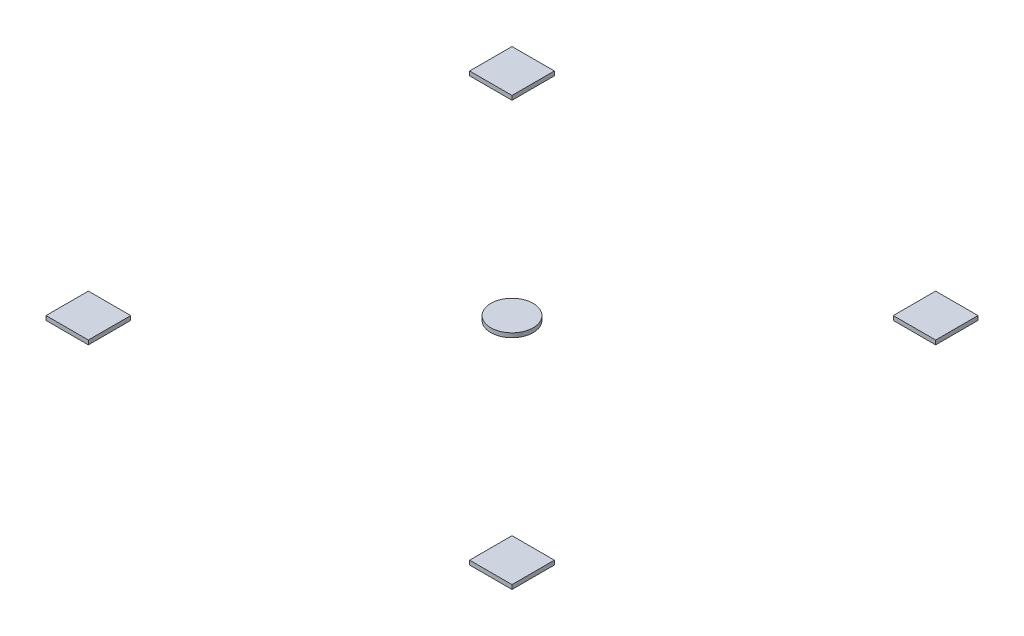
from build123d import *

# Parameters (mm, degrees)
SKIZZE1_R                         = 10
AUFSATZ_LINEAR_AUSTRAGEN1_DEPTH   = 2
SKIZZE1_W                         = 20
SKIZZE1_H                         = 20
AUFSATZ_LINEAR_AUSTRAGEN1_2_DEPTH = 2
AUFSATZ_LINEAR_AUSTRAGEN1_3_DEPTH = 2
AUFSATZ_LINEAR_AUSTRAGEN1_4_DEPTH = 2
AUFSATZ_LINEAR_AUSTRAGEN1_5_DEPTH = 2


with BuildPart() as part:
    # Skizze1 → Aufsatz-Linear austragen1 (new body)
    with BuildSketch(Plane(origin=(0, 0, 0), x_dir=(1, 0, 0), z_dir=(0, 1, 0))):
        Circle(SKIZZE1_R)
    extrude(amount=AUFSATZ_LINEAR_AUSTRAGEN1_DEPTH)


with BuildPart() as body_2:
    # Skizze1 → Aufsatz-Linear austragen1 2 (new body)
    with BuildSketch(Plane(origin=(0, 0, 0), x_dir=(1, 0, 0), z_dir=(0, 1, 0))):
        with Locations((100, 100)):
            Rectangle(SKIZZE1_W, SKIZZE1_H)
    extrude(amount=AUFSATZ_LINEAR_AUSTRAGEN1_2_DEPTH)


with BuildPart() as body_3:
    # Skizze1 → Aufsatz-Linear austragen1 3 (new body)
    with BuildSketch(Plane(origin=(0, 0, 0), x_dir=(1, 0, 0), z_dir=(0, 1, 0))):
        with Locations((-100, 100)):
            Rectangle(SKIZZE1_W, SKIZZE1_H)
    extrude(amount=AUFSATZ_LINEAR_AUSTRAGEN1_3_DEPTH)


with BuildPart() as body_4:
    # Skizze1 → Aufsatz-Linear austragen1 4 (new body)
    with BuildSketch(Plane(origin=(0, 0, 0), x_dir=(1, 0, 0), z_dir=(0, 1, 0))):
        with Locations((100, -100)):
            Rectangle(SKIZZE1_W, SKIZZE1_H)
    extrude(amount=AUFSATZ_LINEAR_AUSTRAGEN1_4_DEPTH)


with BuildPart() as body_5:
    # Skizze1 → Aufsatz-Linear austragen1 5 (new body)
    with BuildSketch(Plane(origin=(0, 0, 0), x_dir=(1, 0, 0), z_dir=(0, 1, 0))):
        with Locations((-100, -100)):
            Rectangle(SKIZZE1_W, SKIZZE1_H)
    extrude(amount=AUFSATZ_LINEAR_AUSTRAGEN1_5_DEPTH)


solid = Compound([part.part, body_2.part, body_3.part, body_4.part, body_5.part])
